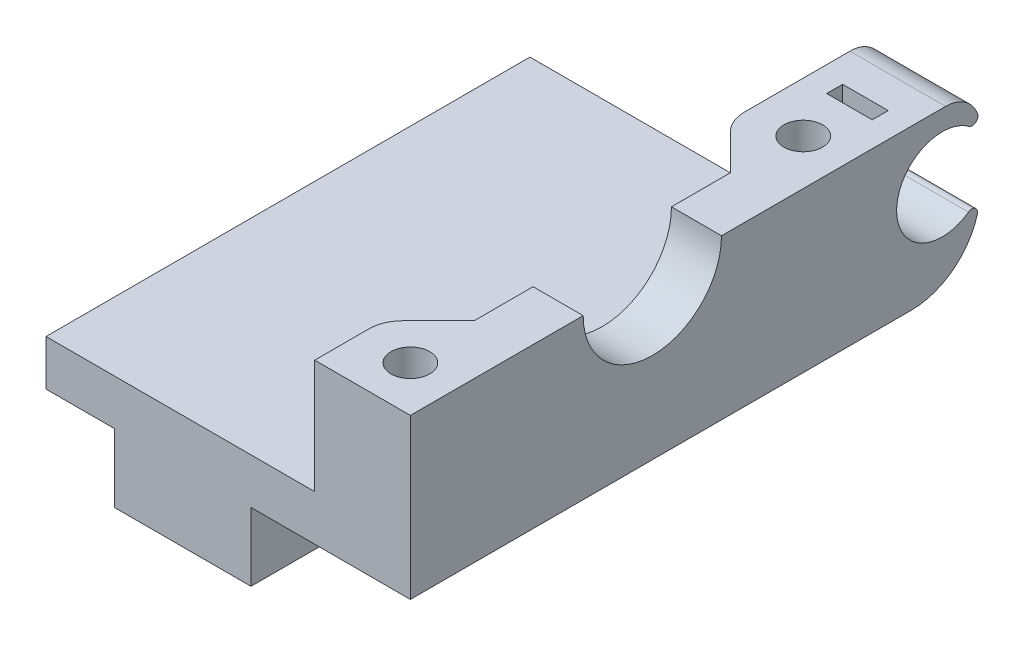
from build123d import *

# Parameters (mm, degrees)
BOSS_EXTRU_1_DEPTH      = 42.5
D_GAGEMENT_M31_D        = 3
ESQUISSE10_W            = 4
ESQUISSE10_H            = 10
BOSS_EXTRU_2_DEPTH      = 10
ESQUISSE12_R            = 6.075
ENL_V_MAT_EXTRU_3_DEPTH = 82.036925103
D_GAGEMENT_M33_D        = 3.4
ENL_V_MAT_EXTRU_1_DEPTH = 1.5
CHANFREIN1_SIZE         = 4
ESQUISSE13_W            = 8
ESQUISSE13_H            = 4
ENL_V_MAT_EXTRU_4_DEPTH = 81.362549025
ESQUISSE14_W            = 8.4
ESQUISSE14_H            = 14
BOSS_EXTRU_3_DEPTH      = 7.5
ESQUISSE15_R            = 4
ENL_V_MAT_EXTRU_5_DEPTH = 79.852350822
CONG_2_R                = 3
CONG_3_R                = 6
CONG_4_R                = 0.5
ESQUISSE16_W            = 4
ESQUISSE16_H            = 1.4
ENL_V_MAT_EXTRU_6_DEPTH = 67.151912076
CONG_5_R                = 3


# Some blends are built 0.0001 mm under size
with BuildPart() as part:
    # Esquisse1 → Boss.-Extru.1 (new body)
    with BuildSketch(Plane(origin=(0, 0, 0), x_dir=(1, 0, 0), z_dir=(0, 0, -1))):
        Polygon((-1.384510159, -46.220398701), (38.615489841, -46.220398701), (38.615489841, -42.220398701), (24.615489841, -42.220398701), (24.615489841, -36.220398701), (12.615489841, -36.220398701), (12.615489841, -42.220398701), (-1.384510159, -42.220398701), align=None)
    extrude(amount=BOSS_EXTRU_1_DEPTH)

    # Dégagement M31 (through all)
    with Locations(Plane(origin=(24.615489841, 0, 0), x_dir=(0, 0, -1), z_dir=(1, 0, 0))):
        with Locations((10, 39.220398701), (32.5, 39.220398701)):
            Hole(D_GAGEMENT_M31_D / 2)

    # Esquisse10 → Boss.-Extru.2 (add)
    with BuildSketch(Plane(origin=(0, 46.220398701, 0), x_dir=(1, 0, 0), z_dir=(0, 1, 0))):
        with Locations((32.215489841, 37.5)):
            Rectangle(ESQUISSE10_W, ESQUISSE10_H)
        Polygon((34.215489841, 10), (34.215489841, 0), (38.615489841, 0), (38.615489841, 42.5), (34.215489841, 42.5), (34.215489841, 32.5), align=None)
        with Locations((32.215489841, 5)):
            Rectangle(ESQUISSE10_W, ESQUISSE10_H)
    extrude(amount=BOSS_EXTRU_2_DEPTH)

    # Esquisse12 → Enlèv. mat.-Extru.3 (cut, through all)
    with BuildSketch(Plane(origin=(38.615489841, 0, 0), x_dir=(0, 0, -1), z_dir=(1, 0, 0))):
        with Locations((21.25, 56.220398701)):
            Circle(ESQUISSE12_R)
    extrude(amount=-ENL_V_MAT_EXTRU_3_DEPTH, mode=Mode.SUBTRACT)

    # Dégagement M33 (through all)
    with Locations(Plane(origin=(0, 42.220398701, 0), x_dir=(-1, 0, 0), z_dir=(0, -1, 0))):
        with Locations((3, -59.94627318), (-34.615489841, 38.5), (-2.615489841, 38.5), (-2.615489841, 4), (-34.615489841, 4)):
            Hole(D_GAGEMENT_M33_D / 2)

    # Esquisse9 → Enlèv. mat.-Extru.1 (cut)
    with BuildSketch(Plane.XZ.offset(-42.220398701)):
        Polygon((32.865489841, -35.468911087), (31.115489841, -38.5), (32.865489841, -41.531088913), (36.365489841, -41.531088913), (38.115489841, -38.5), (36.365489841, -35.468911087), align=None)
        Polygon((4.365489841, -35.468911087), (0.865489841, -35.468911087), (-0.884510159, -38.5), (0.865489841, -41.531088913), (4.365489841, -41.531088913), (6.115489841, -38.5), align=None)
        Polygon((32.865489841, -0.968911087), (31.115489841, -4), (32.865489841, -7.031088913), (36.365489841, -7.031088913), (38.115489841, -4), (36.365489841, -0.968911087), align=None)
        Polygon((4.365489841, -0.968911087), (0.865489841, -0.968911087), (-0.884510159, -4), (0.865489841, -7.031088913), (4.365489841, -7.031088913), (6.115489841, -4), align=None)
    extrude(amount=-ENL_V_MAT_EXTRU_1_DEPTH, mode=Mode.SUBTRACT)

    # Chanfrein1
    chanfrein1_edges = [part.edges().sort_by_distance(p)[0] for p in [
        (30.215489841, 51.220398701, -32.5),
        (30.215489841, 51.220398701, -10),
    ]]
    chamfer(chanfrein1_edges, length=CHANFREIN1_SIZE - 0.0001)  # a hair under: the kernel refuses the full size

    # Esquisse13 → Enlèv. mat.-Extru.4 (cut, through all)
    with BuildSketch(Plane(origin=(0, 0, -42.5), x_dir=(-1, 0, 0), z_dir=(0, 0, -1))):
        with Locations((-2.615489841, 44.220398701)):
            Rectangle(ESQUISSE13_W, ESQUISSE13_H)
    extrude(amount=-ENL_V_MAT_EXTRU_4_DEPTH, mode=Mode.SUBTRACT)

    # Esquisse14 → Boss.-Extru.3 (add)
    with BuildSketch(Plane(origin=(0, 0, -42.5), x_dir=(-1, 0, 0), z_dir=(0, 0, -1))):
        with Locations((-34.415489841, 49.220398701)):
            Rectangle(ESQUISSE14_W, ESQUISSE14_H)
    extrude(amount=BOSS_EXTRU_3_DEPTH)

    # Esquisse15 → Enlèv. mat.-Extru.5 (cut, through all)
    with BuildSketch(Plane.ZY.offset(-30.215489841)):
        with Locations((-46.7, 50.438462286)):
            Circle(ESQUISSE15_R)
    extrude(amount=-ENL_V_MAT_EXTRU_5_DEPTH, mode=Mode.SUBTRACT)

    # Congé2
    cong_2_edges = [part.edges().sort_by_distance(p)[0] for p in [
        (34.415489841, 56.220398701, -50),
    ]]
    fillet(cong_2_edges, radius=CONG_2_R)

    # Congé3
    # the kernel refuses this fillet: 6 mm, written as the material it takes off along each edge
    with BuildSketch(Plane(origin=(53.615489841, 42.220398701, -50), x_dir=(0, 1, 0), z_dir=(-1, 0, 0))) as cong_3_piece_1:
        with BuildLine():
            CenterArc((CONG_3_R, -CONG_3_R), CONG_3_R, 90, 90)
            Line((0, -CONG_3_R), (0, 0))
            Line((0, 0), (CONG_3_R, 0))
        make_face()
    extrude(amount=38.4, mode=Mode.SUBTRACT)

    # Congé4
    cong_4_edges = [part.edges().sort_by_distance(p)[0] for p in [
        (34.415489841, 52.698993197, -50),
        (34.415489841, 48.177709694, -49.999848135),
    ]]
    fillet(cong_4_edges, radius=CONG_4_R)

    # Esquisse16 → Enlèv. mat.-Extru.6 (cut, through all)
    with BuildSketch(Plane(origin=(0, 56.220398701, 0), x_dir=(1, 0, 0), z_dir=(0, 1, 0))):
        with Locations((34.415489841, 43.46034171)):
            Rectangle(ESQUISSE16_W, ESQUISSE16_H)
    extrude(amount=-ENL_V_MAT_EXTRU_6_DEPTH, mode=Mode.SUBTRACT)

    # Congé5
    cong_5_edges = [part.edges().sort_by_distance(p)[0] for p in [
        (30.215489841, 51.220398701, -36.4999),
        (30.215489841, 51.220398701, -6.0001),
    ]]
    fillet(cong_5_edges, radius=CONG_5_R)


solid = part.part
